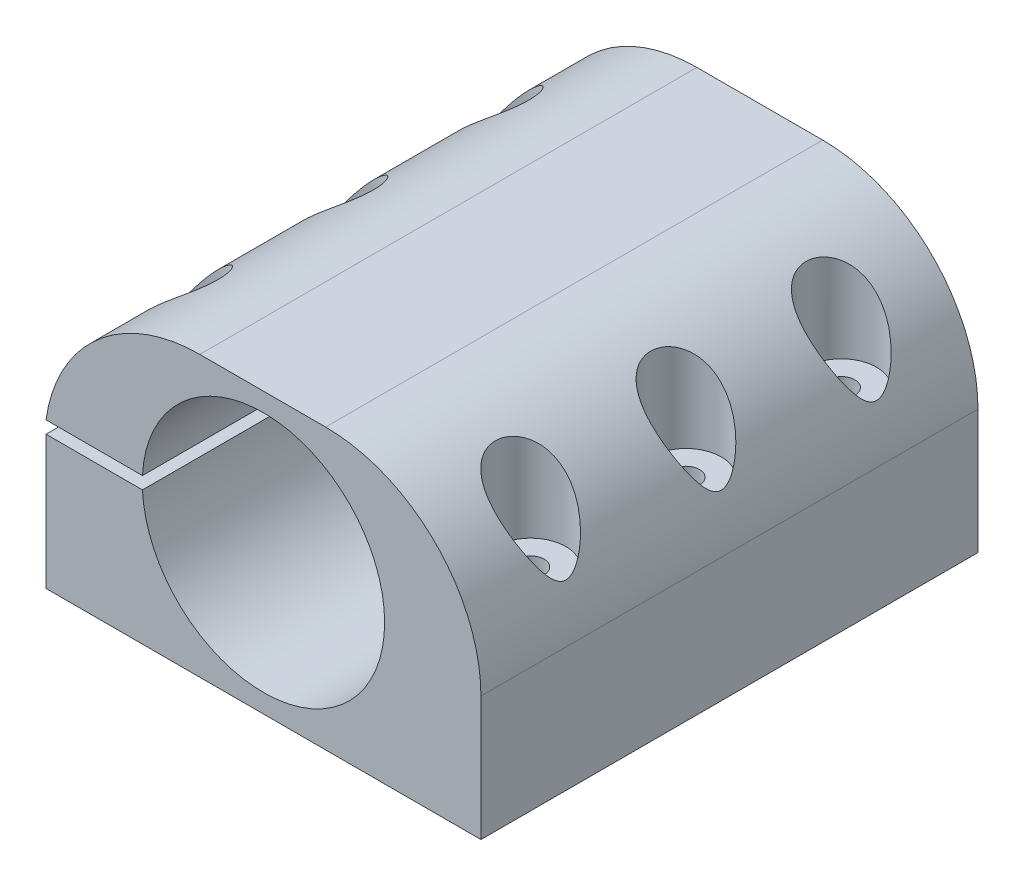
from build123d import *

# Parameters (mm, degrees)
BOSS_EXTRUDE1_DEPTH = 80
CUT_EXTRUDE1_DEPTH  = 99.234413522
SKETCH2_3_R         = 5.675
SKETCH2_3_R_2       = 2.175
CUT_EXTRUDE2_DEPTH  = 18
FILLET3_R           = 25


with BuildPart() as part:
    # Sketch1 → Boss-Extrude1 (new body)
    with BuildSketch(Plane.XY):
        with BuildLine():
            Line((-19.474342094, -1), (-35, -1))
            Line((-35, -1), (-35, -22.5))
            Line((-35, -22.5), (35, -22.5))
            Line((35, -22.5), (35, 22.5))
            Line((35, 22.5), (-35, 22.5))
            Line((-35, 22.5), (-35, 1))
            Line((-35, 1), (-19.474342094, 1))
            ThreePointArc((-19.474342094, 1), (19.5, 0), (-19.474342094, -1))
        make_face()
    extrude(amount=BOSS_EXTRUDE1_DEPTH)

    # Sketch2 → Cut-Extrude1 (cut, through all)
    with BuildSketch(Plane(origin=(0, 22.5, 0), x_dir=(1, 0, 0), z_dir=(0, 1, 0))):
        with BuildLine():
            ThreePointArc((30.175, -65), (29.537957249, -63.462042751), (28, -62.825))
            Line((28, -62.825), (28, -67.175))
            ThreePointArc((28, -67.175), (29.537957249, -66.537957249), (30.175, -65))
        make_face()
        with BuildLine():
            Line((28, -67.175), (28, -62.825))
            ThreePointArc((28, -62.825), (25.825, -65), (28, -67.175))
        make_face()
        with BuildLine():
            ThreePointArc((30.175, -40), (29.537957249, -38.462042751), (28, -37.825))
            Line((28, -37.825), (28, -42.175))
            ThreePointArc((28, -42.175), (29.537957249, -41.537957249), (30.175, -40))
        make_face()
        with BuildLine():
            Line((28, -42.175), (28, -37.825))
            ThreePointArc((28, -37.825), (25.825, -40), (28, -42.175))
        make_face()
        with BuildLine():
            ThreePointArc((30.175, -15), (29.537957249, -13.462042751), (28, -12.825))
            Line((28, -12.825), (28, -17.175))
            ThreePointArc((28, -17.175), (29.537957249, -16.537957249), (30.175, -15))
        make_face()
        with BuildLine():
            Line((28, -17.175), (28, -12.825))
            ThreePointArc((28, -12.825), (25.825, -15), (28, -17.175))
        make_face()
    cut_extrude1 = extrude(amount=-CUT_EXTRUDE1_DEPTH, mode=Mode.SUBTRACT)

    # Sketch2<3> → Cut-Extrude2 (cut)
    # profile 1 of 3: a face of its own
    with BuildSketch(Plane(origin=(0, 22.5, 0), x_dir=(1, 0, 0), z_dir=(0, 1, 0))):
        with Locations(Location((28, -65, 0), (0, 0, 270))):
            Circle(SKETCH2_3_R)
        with Locations(Location((28, -65, 0), (0, 0, 270))):
            Circle(SKETCH2_3_R_2, mode=Mode.SUBTRACT)
    # profile 2 of 3: a face of its own
    with BuildSketch(Plane(origin=(0, 22.5, 0), x_dir=(1, 0, 0), z_dir=(0, 1, 0))):
        with Locations(Location((28, -40, 0), (0, 0, 270))):
            Circle(SKETCH2_3_R)
        with Locations(Location((28, -40, 0), (0, 0, 270))):
            Circle(SKETCH2_3_R_2, mode=Mode.SUBTRACT)
    # profile 3 of 3: a face of its own
    with BuildSketch(Plane(origin=(0, 22.5, 0), x_dir=(1, 0, 0), z_dir=(0, 1, 0))):
        with Locations(Location((28, -15, 0), (0, 0, 270))):
            Circle(SKETCH2_3_R)
        with Locations(Location((28, -15, 0), (0, 0, 270))):
            Circle(SKETCH2_3_R_2, mode=Mode.SUBTRACT)
    cut_extrude2 = extrude(amount=-CUT_EXTRUDE2_DEPTH, mode=Mode.SUBTRACT)

    # Mirror1: Cut-Extrude1, Cut-Extrude2 across plane
    add(cut_extrude1.mirror(Plane(origin=(0, 0, 0), x_dir=(0, 0, 1), z_dir=(1, 0, 0))), mode=Mode.SUBTRACT)
    add(cut_extrude2.mirror(Plane(origin=(0, 0, 0), x_dir=(0, 0, 1), z_dir=(1, 0, 0))), mode=Mode.SUBTRACT)

    # Fillet3
    # the kernel refuses this fillet: 25 mm, written as the material it takes off along each edge
    with BuildSketch(Plane(origin=(-35, 22.5, -61.884468972), x_dir=(1, 0, 0), z_dir=(0, 0, 1))) as fillet3_piece_1:
        with BuildLine():
            CenterArc((24.753787589, -25), FILLET3_R, 90, 81.952153753)
            Line((0, -21.5), (-0.495075752, -21.43))
            ThreePointArc((-0.495075752, -21.43), (-0.5, -10.75), (-0.5, 0))
            Line((-0.5, 0), (0, 0.5))
            Line((0, 0.5), (24.753787589, 0.5))
            Line((24.753787589, 0.5), (24.753787589, 0))
        make_face()
    extrude(amount=203.768937945, mode=Mode.SUBTRACT)
    with BuildSketch(Plane(origin=(35, 22.5, -62.5), x_dir=(0, -1, 0), z_dir=(0, 0, 1))) as fillet3_piece_2:
        with BuildLine():
            CenterArc((FILLET3_R, -FILLET3_R), FILLET3_R, 90, 90)
            Line((0, -FILLET3_R), (-FILLET3_R * 0.02, -FILLET3_R))
            Line((-FILLET3_R * 0.02, -FILLET3_R), (-FILLET3_R * 0.02, FILLET3_R * 0.02))
            Line((-FILLET3_R * 0.02, FILLET3_R * 0.02), (FILLET3_R, FILLET3_R * 0.02))
            Line((FILLET3_R, FILLET3_R * 0.02), (FILLET3_R, 0))
        make_face()
    extrude(amount=205, mode=Mode.SUBTRACT)


solid = part.part
